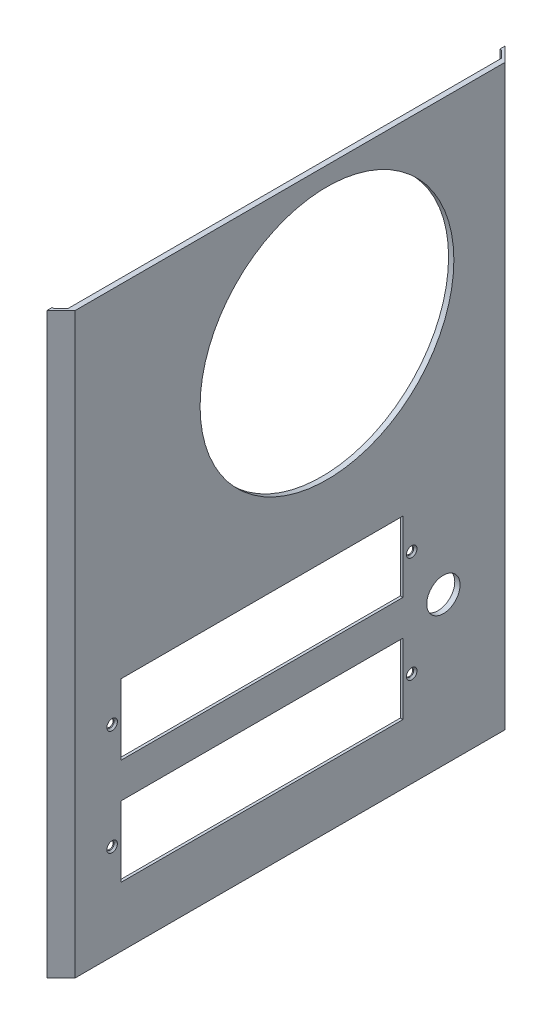
from build123d import *

# Parameters (mm, degrees)
SKETCH1_W                      = 165.076666628
SKETCH1_H                      = 208.28
BOSS_EXTRUDE1_DEPTH            = 5.08
CUT_EXTRUDE1_DEPTH             = 3.175
CUT_EXTRUDE2_REACH             = 134.979
SKETCH8_R                      = 45.72
CUT_EXTRUDE3_REACH             = 134.979
SKETCH9_R                      = 6
SKETCH9_W                      = 101.6
SKETCH9_H                      = 25.4
M2_CLEARANCE_HOLE1_D           = 2.6
M2_CLEARANCE_HOLE1_CSINK_D     = 3.8
M2_CLEARANCE_HOLE1_CSINK_ANGLE = 90
CUT_EXTRUDE4_DEPTH             = 0.9525
CUT_EXTRUDE7_DEPTH             = 4.233333418
CHAMFER1_SIZE                  = 0.635
CHAMFER2_SIZE                  = 2.54
CHAMFER3_SIZE                  = 5.08


with BuildPart() as part:
    # Sketch1 → Boss-Extrude1 (new body)
    with BuildSketch(Plane(origin=(0, 0, 0), x_dir=(0, 0, -1), z_dir=(1, 0, 0))):
        Rectangle(SKETCH1_W, SKETCH1_H)
    extrude(amount=BOSS_EXTRUDE1_DEPTH)

    # Sketch3 → Cut-Extrude1 (cut)
    with BuildSketch(Plane.ZY):
        Polygon((-80.633333314, -12.276666667), (-80.633333314, -78.740000169), (-71.108333314, -78.740000169), (-71.108333314, -87.206666836), (-80.633333314, -87.206666836), (-80.633333314, -104.14), (80.633333314, -104.14), (80.633333314, -87.206666836), (71.108333314, -87.206666836), (71.108333314, -78.740000169), (80.633333314, -78.740000169), (80.633333314, -12.276666667), (71.108333314, -12.276666667), (71.108333314, -3.81), (80.633333314, -3.81), (80.633333314, 78.74), (71.108333314, 78.74), (71.108333314, 87.206666667), (80.633333314, 87.206666667), (80.633333314, 104.14), (-80.633333314, 104.14), (-80.633333314, -3.81), (-71.108333314, -3.81), (-71.108333314, -12.276666667), align=None)
    extrude(amount=-CUT_EXTRUDE1_DEPTH, mode=Mode.SUBTRACT)

    # Sketch8 → Cut-Extrude2 (cut, up to next)
    with BuildSketch(Plane(origin=(5.08, 0, 0), x_dir=(0, 0, -1), z_dir=(1, 0, 0)), mode=Mode.PRIVATE) as cut_extrude2_sk1:
        with Locations((13.288333225, 51.676668489)):
            Circle(SKETCH8_R)
    cut_extrude2_tool1 = extrude(cut_extrude2_sk1.sketch, amount=-CUT_EXTRUDE2_REACH, mode=Mode.PRIVATE) & part.part
    add(cut_extrude2_tool1.solids().sort_by_distance((5.08, 51.676668, -13.288333))[0], mode=Mode.SUBTRACT)

    # Sketch9 → Cut-Extrude3 (cut, up to next)
    with BuildSketch(Plane(origin=(5.08, 0, 0), x_dir=(0, 0, -1), z_dir=(1, 0, 0)), mode=Mode.PRIVATE) as cut_extrude3_sk1:
        with Locations((55.233333314, -50.8)):
            Circle(SKETCH9_R)
    cut_extrude3_tool1 = extrude(cut_extrude3_sk1.sketch, amount=-CUT_EXTRUDE3_REACH, mode=Mode.PRIVATE) & part.part
    # Sketch9 → Cut-Extrude3 (cut, up to next)
    with BuildSketch(Plane(origin=(5.08, 0, 0), x_dir=(0, 0, -1), z_dir=(1, 0, 0)), mode=Mode.PRIVATE) as cut_extrude3_sk2:
        with Locations((-10.148333314, -31.75)):
            Rectangle(SKETCH9_W, SKETCH9_H)
    cut_extrude3_tool2 = extrude(cut_extrude3_sk2.sketch, amount=-CUT_EXTRUDE3_REACH, mode=Mode.PRIVATE) & part.part
    # Sketch9 → Cut-Extrude3 (cut, up to next)
    with BuildSketch(Plane(origin=(5.08, 0, 0), x_dir=(0, 0, -1), z_dir=(1, 0, 0)), mode=Mode.PRIVATE) as cut_extrude3_sk3:
        with Locations((-10.148333314, -69.85)):
            Rectangle(SKETCH9_W, SKETCH9_H)
    cut_extrude3_tool3 = extrude(cut_extrude3_sk3.sketch, amount=-CUT_EXTRUDE3_REACH, mode=Mode.PRIVATE) & part.part
    add(cut_extrude3_tool1.solids().sort_by_distance((5.08, -50.8, -55.233333))[0], mode=Mode.SUBTRACT)
    add(cut_extrude3_tool2.solids().sort_by_distance((5.08, -31.75, 10.148333))[0], mode=Mode.SUBTRACT)
    add(cut_extrude3_tool3.solids().sort_by_distance((5.08, -69.85, 10.148333))[0], mode=Mode.SUBTRACT)

    # M2 Clearance Hole1 (through all)
    with Locations(Plane(origin=(5.08, 0, 0), x_dir=(0, 0, -1), z_dir=(1, 0, 0))):
        with Locations((-64.123333314, -69.85), (43.826666686, -69.85), (43.826666686, -31.75), (-64.123333314, -31.75)):
            CounterSinkHole(M2_CLEARANCE_HOLE1_D / 2, M2_CLEARANCE_HOLE1_CSINK_D / 2, counter_sink_angle=M2_CLEARANCE_HOLE1_CSINK_ANGLE)

    # Sketch12 → Cut-Extrude4 (cut)
    with BuildSketch(Plane.ZY.offset(-3.175)):
        with BuildLine():
            Line((-40.651666686, -16.51), (60.948333314, -16.51))
            Line((60.948333314, -16.51), (65.034587615, -23.682694807))
            ThreePointArc((65.034587615, -23.682694807), (67.171333314, -31.75), (65.034587615, -39.817305193))
            Line((65.034587615, -39.817305193), (60.948333314, -46.99))
            Line((60.948333314, -46.99), (-40.651666686, -46.99))
            Line((-40.651666686, -46.99), (-44.737920986, -39.817305193))
            ThreePointArc((-44.737920986, -39.817305193), (-46.874666686, -31.75), (-44.737920986, -23.682694807))
            Line((-44.737920986, -23.682694807), (-40.651666686, -16.51))
        make_face()
        with BuildLine():
            Line((-44.737920986, -77.917305193), (-40.651666686, -85.09))
            Line((-40.651666686, -85.09), (60.948333314, -85.09))
            Line((60.948333314, -85.09), (65.034587615, -77.917305193))
            ThreePointArc((65.034587615, -77.917305193), (67.171333314, -69.85), (65.034587615, -61.782694807))
            Line((65.034587615, -61.782694807), (60.948333314, -54.61))
            Line((60.948333314, -54.61), (-40.651666686, -54.61))
            Line((-40.651666686, -54.61), (-44.737920986, -61.782694807))
            ThreePointArc((-44.737920986, -61.782694807), (-46.874666686, -69.85), (-44.737920986, -77.917305193))
        make_face()
    extrude(amount=-CUT_EXTRUDE4_DEPTH, mode=Mode.SUBTRACT)

    # Sketch13 → Cut-Extrude7 (cut)
    with BuildSketch(Plane.ZY):
        Polygon((-78.516666732, -8.043333333), (-75.341666732, -4.868333333), (-72.166666732, -8.043333333), (-75.341666732, -11.218333333), align=None)
        Polygon((-78.516666732, -82.973333503), (-75.341666732, -79.798333503), (-72.166666732, -82.973333503), (-75.341666732, -86.148333503), align=None)
        Polygon((72.166666732, -82.973333503), (75.341666732, -79.798333503), (78.516666732, -82.973333503), (75.341666732, -86.148333503), align=None)
        Polygon((72.166666732, -8.043333333), (75.341666732, -4.868333333), (78.516666732, -8.043333333), (75.341666732, -11.218333333), align=None)
        Polygon((72.166666732, 82.973333333), (75.341666732, 86.148333333), (78.516666732, 82.973333333), (75.341666732, 79.798333333), align=None)
    extrude(amount=-CUT_EXTRUDE7_DEPTH, mode=Mode.SUBTRACT)

    # Chamfer1
    chamfer1_edges = [part.edges().sort_by_distance(p)[0] for p in [
        (4.233333418, 81.385833333, 73.754166732),
        (4.233333418, 84.560833333, 73.754166732),
        (4.233333418, 84.560833333, 76.929166732),
        (4.233333418, 81.385833333, 76.929166732),
        (0, 81.385833333, 73.754166732),
        (0, 81.385833333, 76.929166732),
        (0, 84.560833333, 76.929166732),
        (0, 84.560833333, 73.754166732),
        (4.233333418, -9.630833333, 73.754166732),
        (4.233333418, -6.455833333, 73.754166732),
        (4.233333418, -6.455833333, 76.929166732),
        (4.233333418, -9.630833333, 76.929166732),
        (0, -9.630833333, 73.754166732),
        (0, -9.630833333, 76.929166732),
        (0, -6.455833333, 76.929166732),
        (0, -6.455833333, 73.754166732),
        (4.233333418, -84.560833503, 73.754166732),
        (4.233333418, -81.385833503, 73.754166732),
        (4.233333418, -81.385833503, 76.929166732),
        (4.233333418, -84.560833503, 76.929166732),
        (0, -84.560833503, 73.754166732),
        (0, -84.560833503, 76.929166732),
        (0, -81.385833503, 76.929166732),
        (0, -81.385833503, 73.754166732),
        (4.233333418, -84.560833503, -76.929166732),
        (4.233333418, -81.385833503, -76.929166732),
        (4.233333418, -81.385833503, -73.754166732),
        (4.233333418, -84.560833503, -73.754166732),
        (0, -84.560833503, -76.929166732),
        (0, -84.560833503, -73.754166732),
        (0, -81.385833503, -73.754166732),
        (0, -81.385833503, -76.929166732),
        (4.233333418, -9.630833333, -76.929166732),
        (4.233333418, -6.455833333, -76.929166732),
        (4.233333418, -6.455833333, -73.754166732),
        (4.233333418, -9.630833333, -73.754166732),
        (0, -9.630833333, -76.929166732),
        (0, -9.630833333, -73.754166732),
        (0, -6.455833333, -73.754166732),
        (0, -6.455833333, -76.929166732),
    ]]
    chamfer(chamfer1_edges, length=CHAMFER1_SIZE)

    # Chamfer2
    chamfer2_edges = [part.edges().sort_by_distance(p)[0] for p in [
        (3.175, 95.673333333, 80.633333314),
        (3.175, 37.465, 80.633333314),
        (3.175, -45.508333418, 80.633333314),
        (3.175, -95.673333418, 80.633333314),
        (3.175, -95.673333418, -80.633333314),
        (3.175, -45.508333418, -80.633333314),
        (3.175, 50.165, -80.633333314),
    ]]
    chamfer(chamfer2_edges, length=CHAMFER2_SIZE)

    # Chamfer3
    chamfer3_edges = [part.edges().sort_by_distance(p)[0] for p in [
        (5.08, 0, -82.538333314),
        (5.08, 0, 82.538333314),
    ]]
    chamfer(chamfer3_edges, length=CHAMFER3_SIZE - 0.0001)  # a hair under: the kernel refuses the full size


solid = part.part
